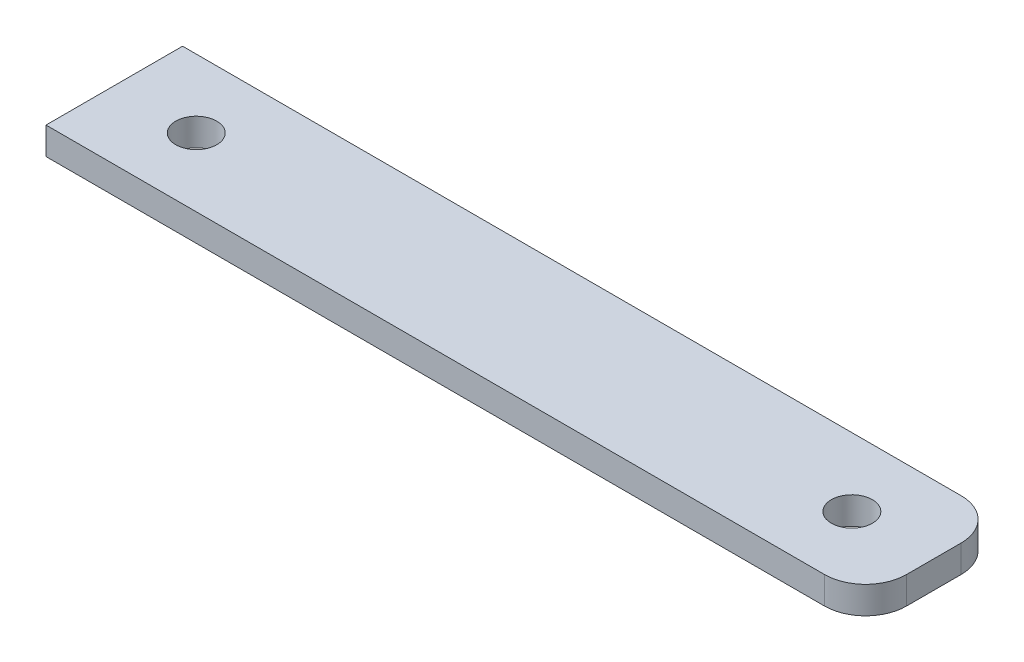
from build123d import *

# Parameters (mm, degrees)
SKETCH1_W             = 60
SKETCH1_H             = 10
BOSS_EXTRUDE1_DEPTH   = 2
FILLET1_R             = 3
F_3_0MM_DOWEL_HOLE1_D = 3


with BuildPart() as part:
    # Sketch1 → Boss-Extrude1 (new body)
    with BuildSketch(Plane(origin=(0, 0, 0), x_dir=(1, 0, 0), z_dir=(0, 1, 0))):
        Rectangle(SKETCH1_W, SKETCH1_H)
    extrude(amount=BOSS_EXTRUDE1_DEPTH)

    # Fillet1
    fillet1_edges = [part.edges().sort_by_distance(p)[0] for p in [
        (30, 1, 5),
        (30, 1, -5),
    ]]
    fillet(fillet1_edges, radius=FILLET1_R)

    # Ø3.0mm Dowel Hole1 (through all)
    with Locations(Plane(origin=(0, 0, 0), x_dir=(-1, 0, 0), z_dir=(0, -1, 0))):
        with Locations((-24, 0), (24, 0)):
            Hole(F_3_0MM_DOWEL_HOLE1_D / 2)


solid = part.part
